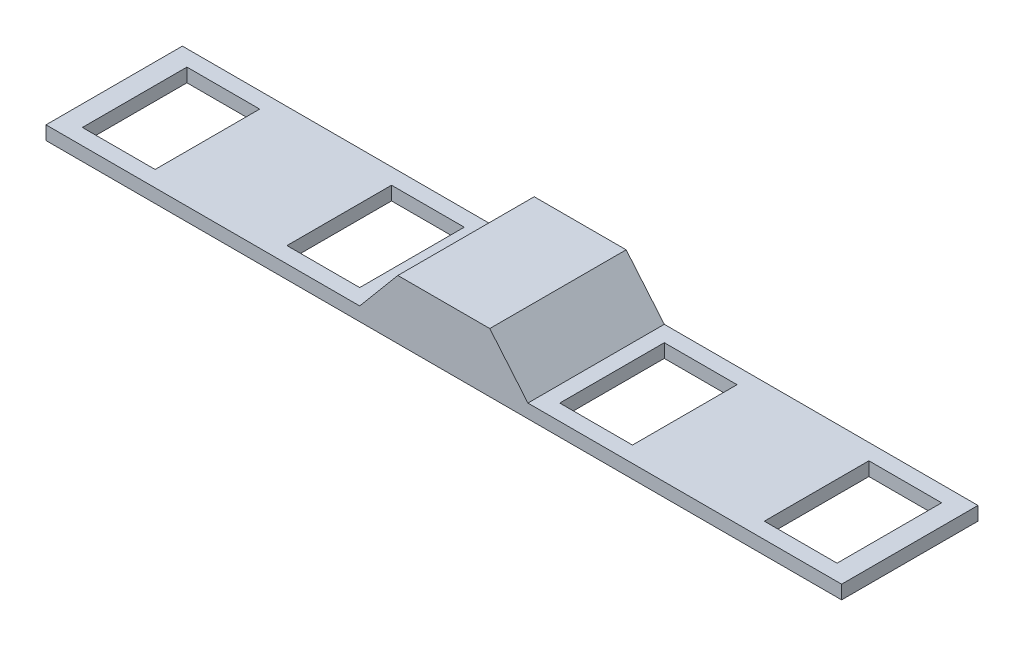
from build123d import *
from OCP.BRepFilletAPI import BRepFilletAPI_MakeChamfer

# Parameters (mm, degrees)
CROQUIS1_W              = 175
CROQUIS1_H              = 30
CROQUIS1_W_2            = 16
CROQUIS1_H_2            = 23
SALIENTE_EXTRUIR1_DEPTH = 3
CROQUIS2_W              = 37
CROQUIS2_H              = 30
SALIENTE_EXTRUIR2_DEPTH = 10
CHAFL_N1_SIZE           = 10
CHAFL_N1_SIZE_2         = 8.390996312


with BuildPart() as part:
    # Croquis1 → Saliente-Extruir1 (new body)
    with BuildSketch(Plane(origin=(0, 0, 0), x_dir=(1, 0, 0), z_dir=(0, 1, 0))):
        Rectangle(CROQUIS1_W, CROQUIS1_H)
        with Locations((-75, 0)):
            Rectangle(CROQUIS1_W_2, CROQUIS1_H_2, mode=Mode.SUBTRACT)
        with Locations((30, 0)):
            Rectangle(CROQUIS1_W_2, CROQUIS1_H_2, mode=Mode.SUBTRACT)
        with Locations((-30, 0)):
            Rectangle(CROQUIS1_W_2, CROQUIS1_H_2, mode=Mode.SUBTRACT)
        with Locations((75, 0)):
            Rectangle(CROQUIS1_W_2, CROQUIS1_H_2, mode=Mode.SUBTRACT)
    extrude(amount=SALIENTE_EXTRUIR1_DEPTH)

    # Croquis2 → Saliente-Extruir2 (add)
    with BuildSketch(Plane(origin=(0, 3, 0), x_dir=(1, 0, 0), z_dir=(0, 1, 0))):
        Rectangle(CROQUIS2_W, CROQUIS2_H)
    extrude(amount=SALIENTE_EXTRUIR2_DEPTH)

    # Chaflán1
    chafl_n1_edges_1 = [part.edges().sort_by_distance(p)[0] for p in [
        (18.5, 13, 0),
    ]]
    chafl_n1_side_1 = [part.faces().sort_by_distance(p)[0] for p in [
        (18.5, 12.832180074, 0),
    ]]
    chafl_n1_edges_2 = [part.edges().sort_by_distance(p)[0] for p in [
        (-18.5, 13, 0),
    ]]
    chafl_n1_side_2 = [part.faces().sort_by_distance(p)[0] for p in [
        (-18.5, 12.832180074, 0),
    ]]
    chafl_n1 = BRepFilletAPI_MakeChamfer(part.part.solid().wrapped)
    for e in chafl_n1_edges_1:
        chafl_n1.Add(CHAFL_N1_SIZE - 0.0001, CHAFL_N1_SIZE_2 - 0.0001, e.wrapped, chafl_n1_side_1[0].wrapped)
    for e in chafl_n1_edges_2:
        chafl_n1.Add(CHAFL_N1_SIZE - 0.0001, CHAFL_N1_SIZE_2 - 0.0001, e.wrapped, chafl_n1_side_2[0].wrapped)
    add(Compound.cast(chafl_n1.Shape()), mode=Mode.REPLACE)  # a hair under: the kernel refuses the full size


solid = part.part
